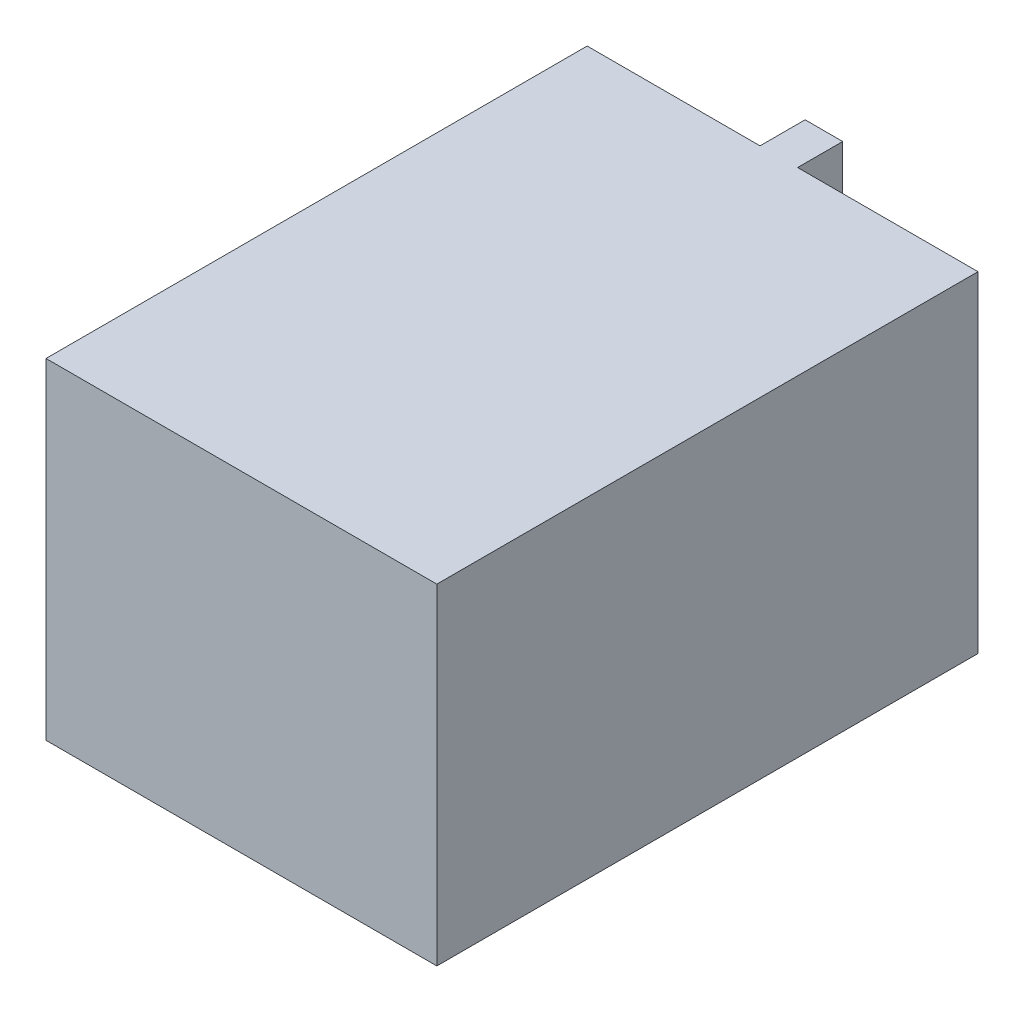
from build123d import *

# Parameters (mm, degrees)
BOSS_EXTRUDE1_DEPTH = 279.4


with BuildPart() as part:
    # Sketch1 → Boss-Extrude1 (new body)
    with BuildSketch(Plane(origin=(0, 0, 0), x_dir=(1, 0, 0), z_dir=(0, 1, 0))):
        Polygon((165.1, 228.6), (165.1, -228.6), (19.05, -228.6), (-19.05, -228.6), (-165.1, -228.6), (-165.1, 228.6), (-19.05, 228.6), (-19.05, 266.7), (12.7, 266.7), (12.7, 228.6), align=None)
    extrude(amount=BOSS_EXTRUDE1_DEPTH)


solid = part.part
